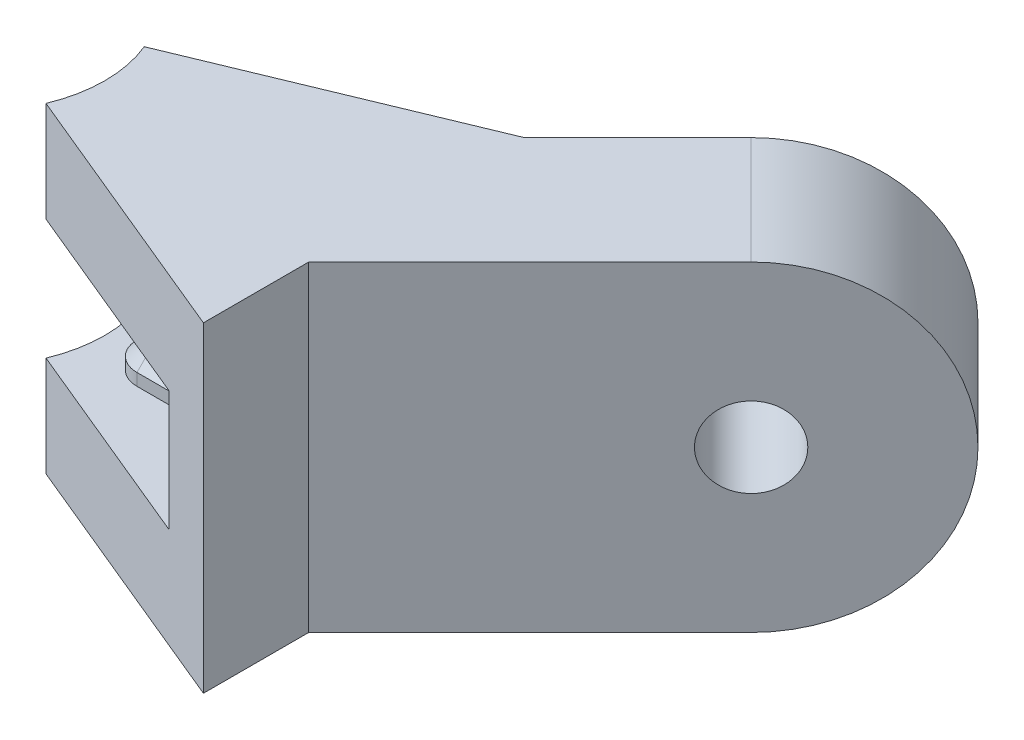
from build123d import *

# Parameters (mm, degrees)
AUFSATZ_LINEAR_AUSTRAGEN1_DEPTH             = 4
SCHNITT_LINEAR_AUSTRAGEN1_DEPTH             = 12.191730608
SCHNITT_LINEAR_AUSTRAGEN1_DEPTH_BACK        = 12.191730608
SKIZZE2_W                                   = 8.2
SKIZZE2_H                                   = 3
AUFSATZ_LINEAR_AUSTRAGEN2_DEPTH             = 0.6
FASE1_SIZE                                  = 0.3
FASE1_OF_SPIEGELN1_SIZE                     = 0.3
AUFSATZ_LINEAR_AUSTRAGEN5_REACH             = 13.192
AUFSATZ_LINEAR_AUSTRAGEN5_DIRECTION_2_REACH = 13.192
VERRUNDUNG2_R                               = 4
SKIZZE15_R                                  = 1
SCHNITT_LINEAR_AUSTRAGEN2_DEPTH             = 21.051946243


with BuildPart() as part:
    # Skizze1 → Aufsatz-Linear austragen1 (new, symmetric)
    with BuildSketch(Plane(origin=(0, 0, 0), x_dir=(1, 0, 0), z_dir=(0, 1, 0))):
        with BuildLine():
            Line((2.956414504, 1.224586984), (9.656854249, 4))
            Line((9.656854249, 4), (9.656854249, -4))
            Line((9.656854249, -4), (2.956414504, -1.224586984))
            ThreePointArc((2.956414504, -1.224586984), (3.2, 0), (2.956414504, 1.224586984))
        make_face()
    extrude(amount=AUFSATZ_LINEAR_AUSTRAGEN1_DEPTH, both=True)

    # Skizze2 → Schnitt-Linear austragen1 (cut, two sides: drawn at the far end of the back side and taken through both)
    with BuildSketch(Plane.XY.offset(-SCHNITT_LINEAR_AUSTRAGEN1_DEPTH_BACK)):
        with Locations((4.1, 0)):
            Rectangle(SKIZZE2_W, SKIZZE2_H)
    extrude(amount=SCHNITT_LINEAR_AUSTRAGEN1_DEPTH + SCHNITT_LINEAR_AUSTRAGEN1_DEPTH_BACK, mode=Mode.SUBTRACT)

    # Skizze7 → Aufsatz-Linear austragen2 (add)
    with BuildSketch(Plane.XZ.offset(-1.5)):
        with BuildLine():
            Line((4.7, 0.7), (5.5, 0.7))
            ThreePointArc((5.5, 0.7), (6.2, 0), (5.5, -0.7))
            Line((5.5, -0.7), (4.7, -0.7))
            ThreePointArc((4.7, -0.7), (4, 0), (4.7, 0.7))
        make_face()
    aufsatz_linear_austragen2 = extrude(amount=AUFSATZ_LINEAR_AUSTRAGEN2_DEPTH)

    # Fase1
    fase1_edges = [part.edges().sort_by_distance(p)[0] for p in [
        (4, 0.9, 0),
        (5.1, 0.9, -0.7),
        (6.2, 0.9, 0),
        (5.1, 0.9, 0.7),
    ]]
    chamfer(fase1_edges, length=FASE1_SIZE)

    # Spiegeln1: Aufsatz-Linear austragen2 across plane
    add(aufsatz_linear_austragen2.mirror(Plane.ZX))

    # Fase1 of Spiegeln1
    fase1_of_spiegeln1_edges = [part.edges().sort_by_distance(p)[0] for p in [
        (4, -0.9, 0),
        (5.1, -0.9, -0.7),
        (6.2, -0.9, 0),
        (5.1, -0.9, 0.7),
    ]]
    chamfer(fase1_of_spiegeln1_edges, length=FASE1_OF_SPIEGELN1_SIZE)

    # Aufsatz-Linear austragen5: up to this face of the body (flat: up to its plane)
    aufsatz_linear_austragen5_end = Plane(part.part.faces().sort_by_distance((6.944416323, 4, 0))[0])
    # Skizze13 → Aufsatz-Linear austragen5 (add, up to the picked face)
    with BuildSketch(Plane(origin=(0, 0, 0), x_dir=(1, 0, 0), z_dir=(0, 1, 0)), mode=Mode.PRIVATE) as aufsatz_linear_austragen5_sk1:
        Polygon((9.656854249, 4), (15.313708499, 9.656854249), (18.000714267, 6.969848481), (9.656854249, -1.374011537), align=None)
    aufsatz_linear_austragen5_tool1 = split(extrude(aufsatz_linear_austragen5_sk1.sketch, amount=AUFSATZ_LINEAR_AUSTRAGEN5_REACH, mode=Mode.PRIVATE), bisect_by=aufsatz_linear_austragen5_end, keep=Keep.BOTH, mode=Mode.PRIVATE)
    add(aufsatz_linear_austragen5_tool1.solids().sort_by(Axis((13.200007, 0, -4.684251), (0, 1, 0)))[0])

    # Aufsatz-Linear austragen5 direction 2: up to this face of the body (flat: up to its plane)
    aufsatz_linear_austragen5_direction_2_end = Plane(part.part.faces().sort_by_distance((6.944416323, -4, 0))[0])
    # Skizze13 → Aufsatz-Linear austragen5 direction 2 (add, up to the picked face)
    with BuildSketch(Plane(origin=(0, 0, 0), x_dir=(1, 0, 0), z_dir=(0, 1, 0)), mode=Mode.PRIVATE) as aufsatz_linear_austragen5_direction_2_sk1:
        Polygon((9.656854249, 4), (15.313708499, 9.656854249), (18.000714267, 6.969848481), (9.656854249, -1.374011537), align=None)
    aufsatz_linear_austragen5_direction_2_tool1 = split(extrude(aufsatz_linear_austragen5_direction_2_sk1.sketch, amount=-AUFSATZ_LINEAR_AUSTRAGEN5_DIRECTION_2_REACH, mode=Mode.PRIVATE), bisect_by=aufsatz_linear_austragen5_direction_2_end, keep=Keep.BOTH, mode=Mode.PRIVATE)
    add(aufsatz_linear_austragen5_direction_2_tool1.solids().sort_by(Axis((13.200007, 0, -4.684251), (0, -1, 0)))[0])

    # Verrundung2
    verrundung2_edges = [part.edges().sort_by_distance(p)[0] for p in [
        (16.657211383, 4, -8.313351365),
        (16.657211383, -4, -8.313351365),
    ]]
    fillet(verrundung2_edges, radius=VERRUNDUNG2_R - 0.0001)  # a hair under: the kernel refuses the full size

    # Skizze15 → Schnitt-Linear austragen2 (cut, through all)
    with BuildSketch(Plane(origin=(5.515432893, 0, 5.515432893), x_dir=(0.707106781186546, 0, -0.707106781186549), z_dir=(0.707106781186549, 0, 0.707106781186546))):
        with Locations((13.656854249, 0)):
            Circle(SKIZZE15_R)
    extrude(amount=-SCHNITT_LINEAR_AUSTRAGEN2_DEPTH, mode=Mode.SUBTRACT)


solid = part.part
